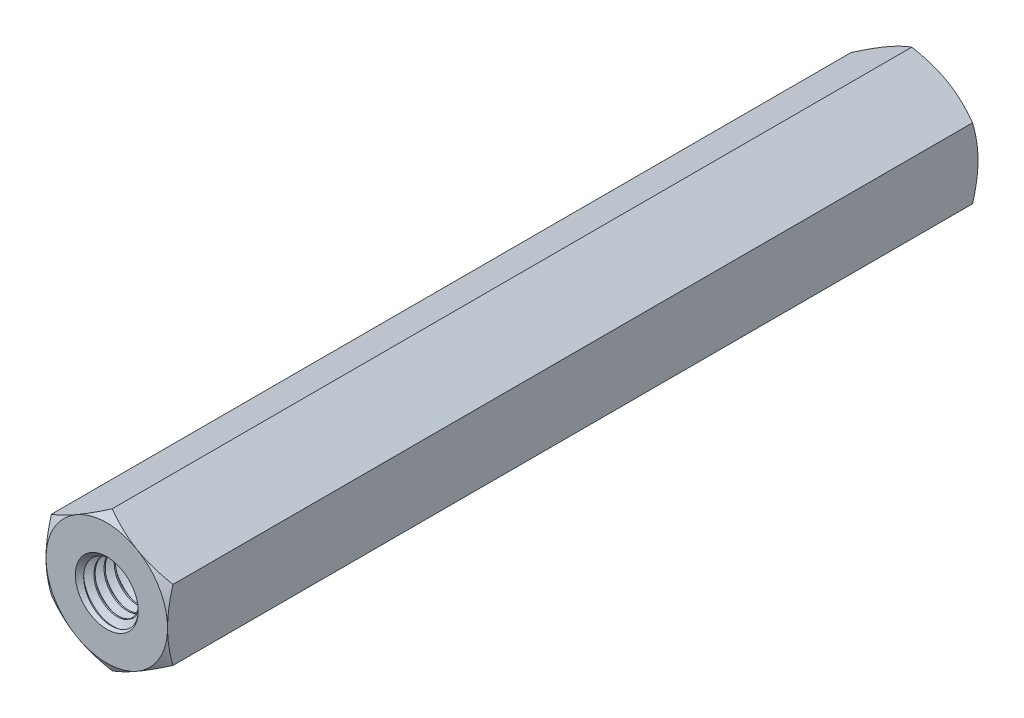
from build123d import *

# Parameters (mm, degrees)
EXTRUDE1_DEPTH          = 31.75
EXTRUDE1_DEPTH_BACK     = 31.75
SKETCH1_R               = 2.413
SWEEP1_PITCH            = 0.79375
EXTRUDE2_DEPTH          = 65.704187324
SKETCH8_OUTSIDE_W       = 252.316
SKETCH8_OUTSIDE_H       = 253.788
SKETCH8_OUTSIDE_R       = 4.7625
EXTRUDE4_DEPTH          = 65.704187324
EXTRUDE4_DRAFT          = -60
MIRROR1_COPY_1_SKETCH_W = 252.316
MIRROR1_COPY_1_SKETCH_H = 253.788
MIRROR1_COPY_1_SKETCH_R = 4.7625
MIRROR1_COPY_1_DEPTH    = 65.704187324
MIRROR1_COPY_1_DRAFT    = -60
SKETCH9_W               = 38.1
SKETCH9_H               = 2.4638


with BuildPart() as part:
    # Sketch1 → Extrude1 (new, two sides: drawn at the far end of the back side and taken through both)
    with BuildSketch(Plane.XY.offset(-EXTRUDE1_DEPTH_BACK)):
        Polygon((0, 5.499261314), (-4.7625, 2.749630657), (-4.7625, -2.749630657), (0, -5.499261314), (4.7625, -2.749630657), (4.7625, 2.749630657), align=None)
        Circle(SKETCH1_R, mode=Mode.SUBTRACT)
    extrude(amount=EXTRUDE1_DEPTH + EXTRUDE1_DEPTH_BACK)

    # Sweep1: arcs per turn and ends read off the stored shape
    # Sweep1: the profile of Sketch12 profile screwed along a right-hand helix through 81 turns, 6 arcs to a turn; built about Z, then put on its axis
    sweep1_z = Axis((0, 0, 0), (0, 0, 1))
    sweep1_corners = [(2.4133, 0, -0.694704455), (2.4133, 0, 0.000173205), (1.897444252, 0, -0.29765625), (1.897444252, 0, -0.396875)]
    with BuildLine(mode=Mode.PRIVATE) as sweep1_profile:
        Line(sweep1_corners[0], sweep1_corners[1])
        Line(sweep1_corners[1], sweep1_corners[2])
        Line(sweep1_corners[2], sweep1_corners[3])
        Line(sweep1_corners[3], sweep1_corners[0])
    sweep1_cap = Face(sweep1_profile.wire())
    sweep1_turn_angles = [0, 30, 60, 90, 120, 150, 180, 210, 240, 270, 300, 330, 360]
    sweep1_turn_weights = [1, 0.8660254037844387, 1, 0.8660254037844387, 1, 0.8660254037844387, 1, 0.8660254037844387, 1, 0.8660254037844387, 1, 0.8660254037844387, 1]
    sweep1_turn_rails = [Edge.make_bspline([Vector(p[0], p[1], 0).rotate(sweep1_z, sweep1_turn_angles[k]) / sweep1_turn_weights[k] + Vector(0, 0, p[2] + SWEEP1_PITCH * sweep1_turn_angles[k] / 360) for k in range(13)], [0, 0, 0, 1, 1, 2, 2, 3, 3, 4, 4, 5, 5, 6, 6, 6], 2, sweep1_turn_weights) for p in sweep1_corners]
    sweep1_turn_sides = [Face.make_surface_from_curves(sweep1_turn_rails[p[0]], sweep1_turn_rails[p[1]]) for p in [(0, 1), (1, 2), (2, 3), (3, 0)]]
    sweep1 = Plane(origin=(0, 0, -31.75), x_dir=(0, 1, 0), z_dir=(0, 0, 1)) * Solid(Shell([*[p.moved(Location((0, 0, SWEEP1_PITCH * i))) for i in range(81) for p in sweep1_turn_sides], sweep1_cap, sweep1_cap.rotate(sweep1_z, 29160).moved(Location((0, 0, SWEEP1_PITCH * 29160 / 360)))]))
    add(sweep1)

    # Sketch6 → Extrude2 (cut, through all)
    with BuildSketch(Plane(origin=(0, 0, -31.75), x_dir=(-1, 0, 0), z_dir=(0, 0, -1))):
        Polygon((0, 5.499261314), (-4.7625, 2.749630657), (-4.7625, -2.749630657), (0, -5.499261314), (4.7625, -2.749630657), (4.7625, 2.749630657), align=None)
    extrude2 = extrude(amount=EXTRUDE2_DEPTH, mode=Mode.SUBTRACT)

    # Extrude3 cone 1 section (through the dimple's axis) → Extrude3 (revolve, cut)
    with BuildSketch(Plane(origin=(0, 0, -31.75), x_dir=(0, 1, 0), z_dir=(1, 0, 0))):
        Polygon((0, 0), (2.4638, 0), (0, 2.642102028), align=None)
    extrude3 = revolve(axis=Axis((0, 0, -31.75), (0, 0, 1)), mode=Mode.SUBTRACT)


with BuildPart() as extrude4_tool:
    # Sketch8 outside → Extrude4 (with draft: the straight prism first)
    with BuildSketch(Plane(origin=(0, 0, -31.75), x_dir=(-1, 0, 0), z_dir=(0, 0, -1))):
        Rectangle(SKETCH8_OUTSIDE_W, SKETCH8_OUTSIDE_H)
        Circle(SKETCH8_OUTSIDE_R, mode=Mode.SUBTRACT)
    extrude(amount=-EXTRUDE4_DEPTH)
    # Extrude4: the draft: its side faces are tilted about the plane it starts from
    extrude4_sides = [extrude4_tool.faces().sort_by_distance(p)[0] for p in [
        (0, -126.894, 1.102093662),
        (-126.158, 0, 1.102093662),
        (0, 126.894, 1.102093662),
        (126.158, 0, 1.102093662),
        (4.7625, 0, 1.102093662),
    ]]
    draft(extrude4_sides, Plane(origin=(0, 0, -31.75), x_dir=(-1, 0, 0), z_dir=(0, 0, -1)), EXTRUDE4_DRAFT)


with BuildPart() as part_1:
    add(part.part)

    # Extrude4: cut by extrude4_tool
    add(extrude4_tool.part, mode=Mode.SUBTRACT)

    # Mirror1: Extrude2, Extrude3 across plane
    add(extrude2.mirror(Plane.XY), mode=Mode.SUBTRACT)
    add(extrude3.mirror(Plane.XY), mode=Mode.SUBTRACT)


with BuildPart() as mirror1_copy_1_tool:
    # Mirror1 copy 1 sketch → Mirror1 copy 1 (with draft: the straight prism first)
    with BuildSketch(Plane(origin=(0, 0, 31.75), x_dir=(-1, 0, 0), z_dir=(0, 0, 1))):
        Rectangle(MIRROR1_COPY_1_SKETCH_W, MIRROR1_COPY_1_SKETCH_H)
        Circle(MIRROR1_COPY_1_SKETCH_R, mode=Mode.SUBTRACT)
    extrude(amount=-MIRROR1_COPY_1_DEPTH)
    # Mirror1 copy 1: the draft: its side faces are tilted about the plane it starts from
    mirror1_copy_1_sides = [mirror1_copy_1_tool.faces().sort_by_distance(p)[0] for p in [
        (0, -126.894, -1.102093662),
        (-126.158, 0, -1.102093662),
        (0, 126.894, -1.102093662),
        (126.158, 0, -1.102093662),
        (4.7625, 0, -1.102093662),
    ]]
    draft(mirror1_copy_1_sides, Plane(origin=(0, 0, 31.75), x_dir=(-1, 0, 0), z_dir=(0, 0, 1)), MIRROR1_COPY_1_DRAFT)


with BuildPart() as part_2:
    add(part_1.part)

    # Mirror1 copy 1: cut by mirror1_copy_1_tool
    add(mirror1_copy_1_tool.part, mode=Mode.SUBTRACT)

    # Sketch9 → Revolve 2 (revolve)
    with BuildSketch(Plane(origin=(0, 0, 0), x_dir=(0, 0, -1), z_dir=(1, 0, 0)), mode=Mode.PRIVATE) as revolve_2_sk:
        with Locations((0, 1.2319)):
            Rectangle(SKETCH9_W, SKETCH9_H)
    revolve(revolve_2_sk.sketch.rotate(Axis((0, 0, 31.75), (0, 0, -1)), 270), axis=Axis((0, 0, 31.75), (0, 0, -1)))


solid = part_2.part
